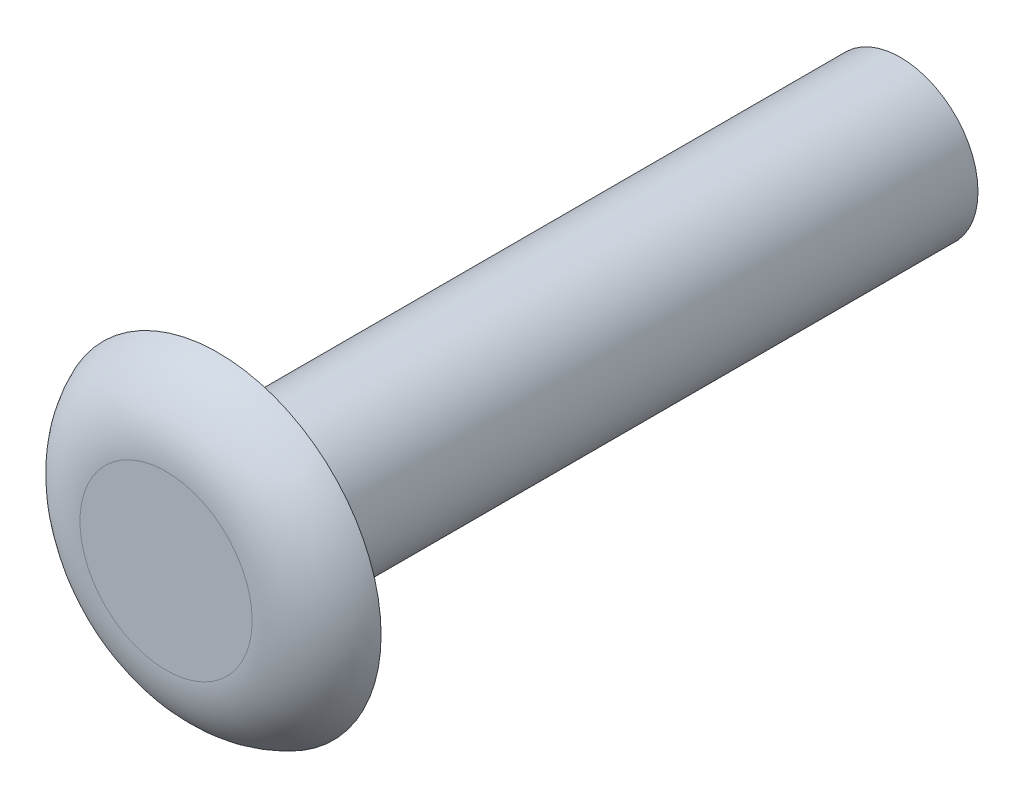
from build123d import *

# Parameters (mm, degrees)
SKETCH1_R           = 5.0038
BOSS_EXTRUDE1_DEPTH = 1.6002
SKETCH2_R           = 2.38125
BOSS_EXTRUDE2_DEPTH = 20.955
FILLET1_R           = 2.54


with BuildPart() as part:
    # Sketch1 → Boss-Extrude1 (new body)
    with BuildSketch(Plane.XY):
        Circle(SKETCH1_R)
    extrude(amount=BOSS_EXTRUDE1_DEPTH)

    # Sketch2 → Boss-Extrude2 (add)
    with BuildSketch(Plane.XY):
        Circle(SKETCH2_R)
    extrude(amount=-BOSS_EXTRUDE2_DEPTH)

    # Fillet1
    # the kernel refuses this fillet: 2.54 mm, written as the material it takes off along each edge
    with BuildSketch(Plane(origin=(0, 0, 1.6002), x_dir=(1, 0, 0), z_dir=(0, -1, 0))) as fillet1_piece_1:
        with BuildLine():
            CenterArc((2.644059345, -2.54), FILLET1_R, 21.715617283, 68.284382717)
            Line((2.644059345, 0), (2.644059345, 0.0508))
            Line((2.644059345, 0.0508), (5.0038, 0.0508))
            Line((5.0038, 0.0508), (5.0546, 0))
            ThreePointArc((5.0546, 0), (5.0546, -0.8001), (5.050994813, -1.581404))
            Line((5.050994813, -1.581404), (5.0038, -1.6002))
        make_face()
    revolve(axis=Axis((0, 0, 1.6002), (0, 0, 1)), mode=Mode.SUBTRACT)


solid = part.part
